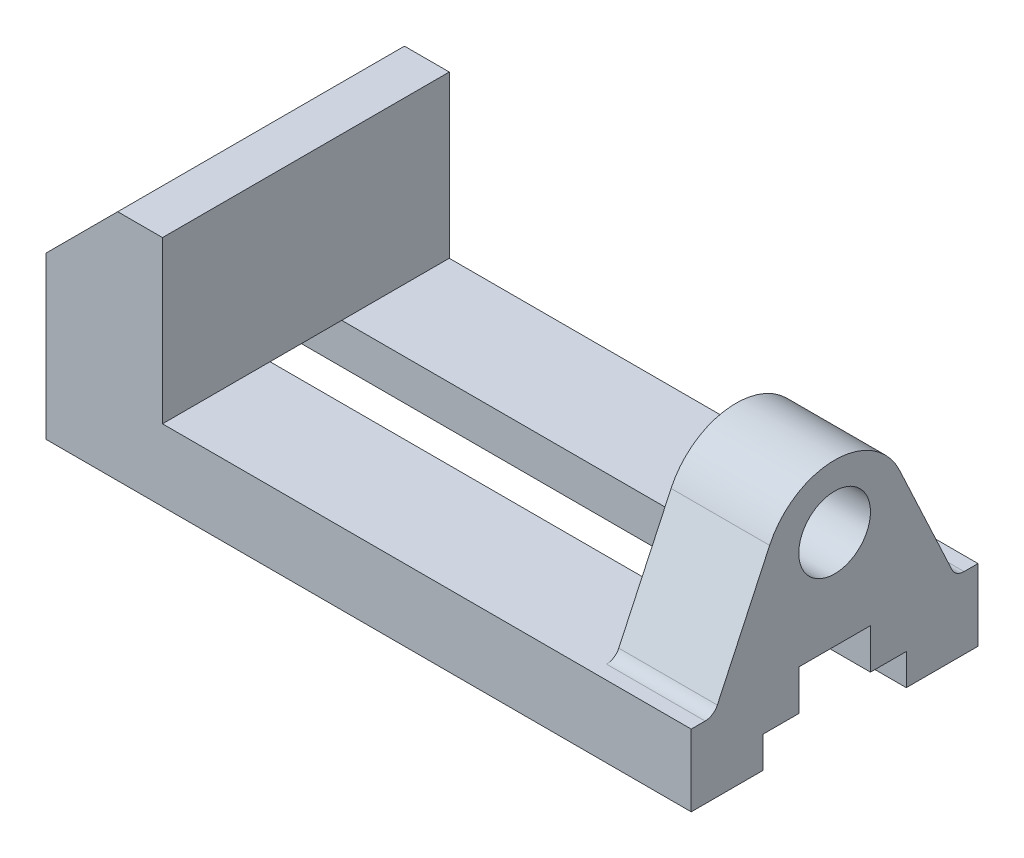
from build123d import *

# Parameters (mm, degrees)
BOSS_EXTRUDE1_DEPTH                   = 64
SKETCH4_R                             = 8
CUT_EXTRUDE1_DEPTH                    = 22
CUT_EXTRUDE2_DEPTH                    = 166.939748102
TAP_DRILL_FOR_M6X1_0_TAP2_D           = 5
TAP_DRILL_FOR_M6X1_0_TAP2_DEPTH       = 10
TAP_DRILL_FOR_M6X1_0_TAP2_CSINK_D     = 5.05
TAP_DRILL_FOR_M6X1_0_TAP2_CSINK_ANGLE = 90
TAP_DRILL_FOR_M6X1_0_TAP2_TIP         = 1.502151548


with BuildPart() as part:
    # Sketch1 → Boss-Extrude1 (new body)
    with BuildSketch(Plane.XY):
        Polygon((0, 0), (144, 0), (144, 16), (144, 52), (122, 52), (122, 16), (26, 16), (26, 52), (16, 52), (0, 36), (0, 16), align=None)
    extrude(amount=BOSS_EXTRUDE1_DEPTH)

    # Sketch4 → Cut-Extrude1 (cut)
    with BuildSketch(Plane(origin=(144, 0, 0), x_dir=(0, 0, -1), z_dir=(1, 0, 0))):
        with BuildLine():
            Line((0, 52), (-32.000000005, 52))
            ThreePointArc((-32.000000005, 52), (-23.403206269, 49.494263134), (-17.499075407, 42.761892188))
            Line((-17.499075407, 42.761892188), (-5.827512712, 17.732145215))
            ThreePointArc((-5.827512712, 17.732145215), (-4.720488176, 16.469825663), (-3.108589351, 16))
            Line((-3.108589351, 16), (0, 16))
            Line((0, 16), (0, 52))
        make_face()
        with BuildLine():
            Line((-58.172487288, 17.732145215), (-46.500924593, 42.761892188))
            ThreePointArc((-46.500924593, 42.761892188), (-40.596793736, 49.494263132), (-32.000000005, 52))
            Line((-32.000000005, 52), (-64, 52))
            Line((-64, 52), (-64, 16))
            Line((-64, 16), (-60.891410649, 16))
            ThreePointArc((-60.891410649, 16), (-59.279511824, 16.469825663), (-58.172487288, 17.732145215))
        make_face()
        with Locations((-32, 38)):
            Circle(SKETCH4_R)
    extrude(amount=-CUT_EXTRUDE1_DEPTH, mode=Mode.SUBTRACT)

    # Sketch4<3> → Cut-Extrude2 (cut, through all)
    with BuildSketch(Plane(origin=(144, 0, 0), x_dir=(0, 0, -1), z_dir=(1, 0, 0))):
        Polygon((-24, 16), (-40, 16), (-40, 7), (-48, 7), (-48, 0), (-16, 0), (-16, 7), (-24, 7), align=None)
    extrude(amount=-CUT_EXTRUDE2_DEPTH, mode=Mode.SUBTRACT)

    # Tap Drill for M6x1.0 Tap2
    with Locations(Plane(origin=(0, 0, 0), x_dir=(-1, 0, 0), z_dir=(0, -1, 0))):
        with Locations((-36, -54), (-106, -54), (-106, -10), (-36, -10)):
            CounterSinkHole(TAP_DRILL_FOR_M6X1_0_TAP2_D / 2, TAP_DRILL_FOR_M6X1_0_TAP2_CSINK_D / 2, depth=TAP_DRILL_FOR_M6X1_0_TAP2_DEPTH, counter_sink_angle=TAP_DRILL_FOR_M6X1_0_TAP2_CSINK_ANGLE)
            with Locations((0, 0, -(TAP_DRILL_FOR_M6X1_0_TAP2_DEPTH + TAP_DRILL_FOR_M6X1_0_TAP2_TIP / 2))):  # 118° drill point
                Cone(0, TAP_DRILL_FOR_M6X1_0_TAP2_D / 2, TAP_DRILL_FOR_M6X1_0_TAP2_TIP, mode=Mode.SUBTRACT)


solid = part.part
